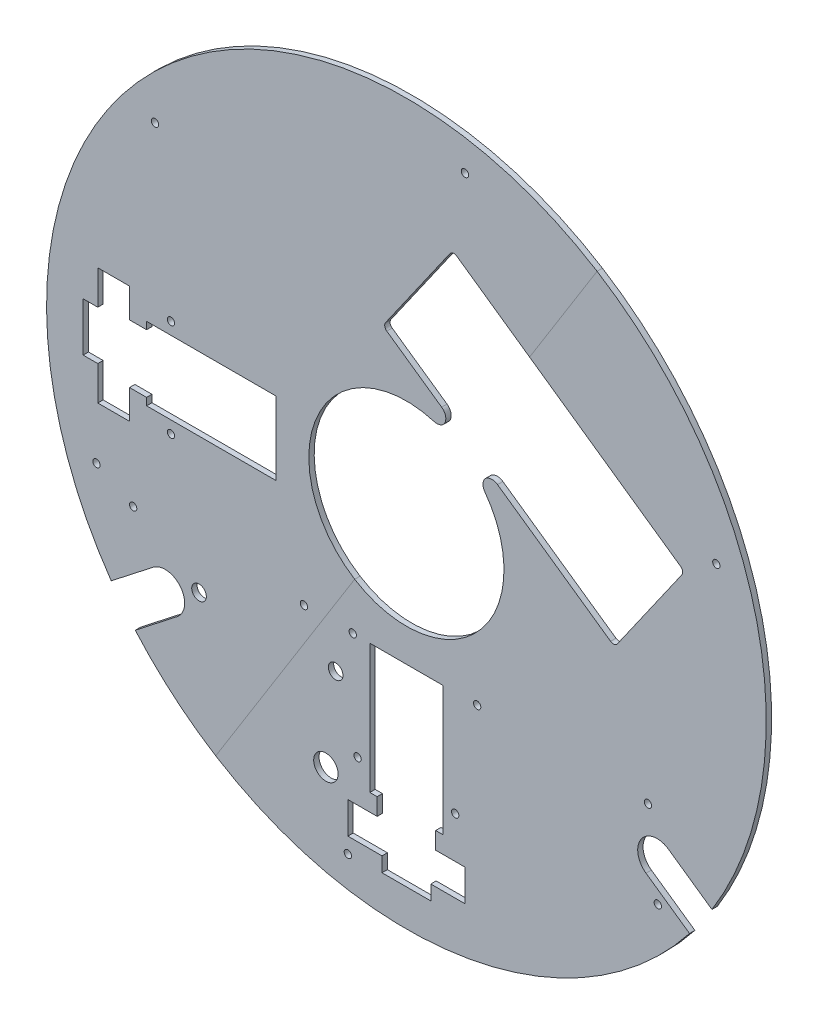
from build123d import *

# Parameters (mm, degrees)
SKETCH1_R           = 147.5
BOSS_EXTRUDE1_DEPTH = 2.2
CUT_EXTRUDE1_REACH  = 210.608
CUT_EXTRUDE2_REACH  = 210.608
SKETCH3_R           = 1.5
CIRPATTERN2_COUNT   = 2
CIRPATTERN2_ANGLE   = 90
CUT_EXTRUDE3_REACH  = 210.608
SKETCH4_R           = 1.5
CIRPATTERN3_COUNT   = 6
CUT_EXTRUDE4_REACH  = 210.608
SKETCH5_R           = 40
CUT_EXTRUDE5_REACH  = 210.608
SKETCH6_R           = 5
CUT_EXTRUDE6_REACH  = 210.608
SKETCH7_R           = 3
CUT_EXTRUDE7_REACH  = 210.608
SKETCH8_R           = 1.5
CUT_EXTRUDE8_REACH  = 210.608
CIRPATTERN4_COUNT   = 2
CIRPATTERN4_ANGLE   = 107
CUT_EXTRUDE9_REACH  = 210.608
CUT_EXTRUDE10_REACH = 210.608
FILLET2_R           = 4
FILLET3_R           = 2


# Read off the part's stored shape, not the designer's step: Split1
with BuildPart() as part:
    # Sketch1 → Boss-Extrude1 (new body)
    with BuildSketch(Plane.XY):
        Circle(SKETCH1_R)
    extrude(amount=BOSS_EXTRUDE1_DEPTH)

    # Sketch2 → Cut-Extrude1 (cut, up to next)
    with BuildSketch(Plane.XY.offset(2.2), mode=Mode.PRIVATE) as cut_extrude1_sk1:
        Polygon((-10, -132.5), (10, -132.5), (10, -126.5), (24, -126.5), (24, -113.5), (12, -113.5), (12, -106.5), (15, -106.5), (15, -53.5), (-15, -53.5), (-15, -106.5), (-12, -106.5), (-12, -113.5), (-24, -113.5), (-24, -126.5), (-10, -126.5), align=None)
    cut_extrude1_tool1 = extrude(cut_extrude1_sk1.sketch, amount=-CUT_EXTRUDE1_REACH, mode=Mode.PRIVATE) & part.part
    cut_extrude1 = cut_extrude1_tool1.solids().sort_by_distance((0, -94.364508, 2.2))[0]
    add(cut_extrude1, mode=Mode.SUBTRACT)

    # Sketch3 → Cut-Extrude2 (cut, up to next)
    with BuildSketch(Plane.XY.offset(2.2), mode=Mode.PRIVATE) as cut_extrude2_sk1:
        with Locations((20, -96.5)):
            Circle(SKETCH3_R)
    cut_extrude2_tool1 = extrude(cut_extrude2_sk1.sketch, amount=-CUT_EXTRUDE2_REACH, mode=Mode.PRIVATE) & part.part
    # Sketch3 → Cut-Extrude2 (cut, up to next)
    with BuildSketch(Plane.XY.offset(2.2), mode=Mode.PRIVATE) as cut_extrude2_sk2:
        with Locations((-20, -96.5)):
            Circle(SKETCH3_R)
    cut_extrude2_tool2 = extrude(cut_extrude2_sk2.sketch, amount=-CUT_EXTRUDE2_REACH, mode=Mode.PRIVATE) & part.part
    cut_extrude2_1 = cut_extrude2_tool1.solids().sort_by_distance((20, -96.5, 2.2))[0]
    add(cut_extrude2_1, mode=Mode.SUBTRACT)
    cut_extrude2_2 = cut_extrude2_tool2.solids().sort_by_distance((-20, -96.5, 2.2))[0]
    add(cut_extrude2_2, mode=Mode.SUBTRACT)
    cut_extrude2 = cut_extrude2_1 + cut_extrude2_2  # Cut-Extrude2 as one shape, for the pattern or mirror that repeats it

    # CirPattern2: Cut-Extrude1, Cut-Extrude2 ×2 about axis
    cirpattern2_axis = Axis((0, 0, 0), (0, 0, -1))
    add([cut_extrude1.rotate(cirpattern2_axis, i * CIRPATTERN2_ANGLE / (CIRPATTERN2_COUNT - 1)) for i in range(1, CIRPATTERN2_COUNT)], mode=Mode.SUBTRACT)
    add([cut_extrude2.rotate(cirpattern2_axis, i * CIRPATTERN2_ANGLE / (CIRPATTERN2_COUNT - 1)) for i in range(1, CIRPATTERN2_COUNT)], mode=Mode.SUBTRACT)

    # Sketch4 → Cut-Extrude3 (cut, up to next)
    with BuildSketch(Plane.XY.offset(2.2), mode=Mode.PRIVATE) as cut_extrude3_sk1:
        with Locations((-24, -132.849538953)):
            Circle(SKETCH4_R)
    cut_extrude3_tool1 = extrude(cut_extrude3_sk1.sketch, amount=-CUT_EXTRUDE3_REACH, mode=Mode.PRIVATE) & part.part
    cut_extrude3 = cut_extrude3_tool1.solids().sort_by_distance((-24, -132.849539, 2.2))[0]
    add(cut_extrude3, mode=Mode.SUBTRACT)

    # CirPattern3: Cut-Extrude3 ×6 about axis
    cirpattern3_axis = Axis((0, 0, 0), (0, 0, 1))
    for i in range(1, CIRPATTERN3_COUNT):
        add(cut_extrude3.rotate(cirpattern3_axis, i * 360 / CIRPATTERN3_COUNT), mode=Mode.SUBTRACT)

    # Sketch5 → Cut-Extrude4 (cut, up to next)
    with BuildSketch(Plane.XY.offset(2.2), mode=Mode.PRIVATE) as cut_extrude4_sk1:
        Circle(SKETCH5_R)
    cut_extrude4_tool1 = extrude(cut_extrude4_sk1.sketch, amount=-CUT_EXTRUDE4_REACH, mode=Mode.PRIVATE) & part.part
    add(cut_extrude4_tool1.solids().sort_by_distance((0, 0, 2.2))[0], mode=Mode.SUBTRACT)

    # Sketch6 → Cut-Extrude5 (cut, up to next)
    with BuildSketch(Plane.XY.offset(2.2), mode=Mode.PRIVATE) as cut_extrude5_sk1:
        with Locations((-33, -106.5)):
            Circle(SKETCH6_R)
    cut_extrude5_tool1 = extrude(cut_extrude5_sk1.sketch, amount=-CUT_EXTRUDE5_REACH, mode=Mode.PRIVATE) & part.part
    add(cut_extrude5_tool1.solids().sort_by_distance((-33, -106.5, 2.2))[0], mode=Mode.SUBTRACT)

    # Sketch7 → Cut-Extrude6 (cut, up to next)
    with BuildSketch(Plane.XY.offset(2.2), mode=Mode.PRIVATE) as cut_extrude6_sk1:
        with Locations((-29, -70.5)):
            Circle(SKETCH7_R)
    cut_extrude6_tool1 = extrude(cut_extrude6_sk1.sketch, amount=-CUT_EXTRUDE6_REACH, mode=Mode.PRIVATE) & part.part
    # Sketch7 → Cut-Extrude6 (cut, up to next)
    with BuildSketch(Plane.XY.offset(2.2), mode=Mode.PRIVATE) as cut_extrude6_sk2:
        with Locations((-85, -70.5)):
            Circle(SKETCH7_R)
    cut_extrude6_tool2 = extrude(cut_extrude6_sk2.sketch, amount=-CUT_EXTRUDE6_REACH, mode=Mode.PRIVATE) & part.part
    add(cut_extrude6_tool1.solids().sort_by_distance((-29, -70.5, 2.2))[0], mode=Mode.SUBTRACT)
    add(cut_extrude6_tool2.solids().sort_by_distance((-85, -70.5, 2.2))[0], mode=Mode.SUBTRACT)

    # Sketch8 → Cut-Extrude7 (cut, up to next)
    with BuildSketch(Plane.XY.offset(2.2), mode=Mode.PRIVATE) as cut_extrude7_sk1:
        with Locations((29, -53.5)):
            Circle(SKETCH8_R)
    cut_extrude7_tool1 = extrude(cut_extrude7_sk1.sketch, amount=-CUT_EXTRUDE7_REACH, mode=Mode.PRIVATE) & part.part
    # Sketch8 → Cut-Extrude7 (cut, up to next)
    with BuildSketch(Plane.XY.offset(2.2), mode=Mode.PRIVATE) as cut_extrude7_sk2:
        with Locations((99, -53.5)):
            Circle(SKETCH8_R)
    cut_extrude7_tool2 = extrude(cut_extrude7_sk2.sketch, amount=-CUT_EXTRUDE7_REACH, mode=Mode.PRIVATE) & part.part
    # Sketch8 → Cut-Extrude7 (cut, up to next)
    with BuildSketch(Plane.XY.offset(2.2), mode=Mode.PRIVATE) as cut_extrude7_sk3:
        with Locations((-22, -53.5)):
            Circle(SKETCH8_R)
    cut_extrude7_tool3 = extrude(cut_extrude7_sk3.sketch, amount=-CUT_EXTRUDE7_REACH, mode=Mode.PRIVATE) & part.part
    # Sketch8 → Cut-Extrude7 (cut, up to next)
    with BuildSketch(Plane.XY.offset(2.2), mode=Mode.PRIVATE) as cut_extrude7_sk4:
        with Locations((-42, -53.5)):
            Circle(SKETCH8_R)
    cut_extrude7_tool4 = extrude(cut_extrude7_sk4.sketch, amount=-CUT_EXTRUDE7_REACH, mode=Mode.PRIVATE) & part.part
    # Sketch8 → Cut-Extrude7 (cut, up to next)
    with BuildSketch(Plane.XY.offset(2.2), mode=Mode.PRIVATE) as cut_extrude7_sk5:
        with Locations((-112, -53.5)):
            Circle(SKETCH8_R)
    cut_extrude7_tool5 = extrude(cut_extrude7_sk5.sketch, amount=-CUT_EXTRUDE7_REACH, mode=Mode.PRIVATE) & part.part
    add(cut_extrude7_tool1.solids().sort_by_distance((29, -53.5, 2.2))[0], mode=Mode.SUBTRACT)
    add(cut_extrude7_tool2.solids().sort_by_distance((99, -53.5, 2.2))[0], mode=Mode.SUBTRACT)
    add(cut_extrude7_tool3.solids().sort_by_distance((-22, -53.5, 2.2))[0], mode=Mode.SUBTRACT)
    add(cut_extrude7_tool4.solids().sort_by_distance((-42, -53.5, 2.2))[0], mode=Mode.SUBTRACT)
    add(cut_extrude7_tool5.solids().sort_by_distance((-112, -53.5, 2.2))[0], mode=Mode.SUBTRACT)

    # Sketch9 → Cut-Extrude8 (cut, up to next)
    with BuildSketch(Plane.XY.offset(2.2), mode=Mode.PRIVATE) as cut_extrude8_sk1:
        with BuildLine():
            Line((116.236315042, -91.155740716), (125.413538023, -78.049308007))
            Line((125.413538023, -78.049308007), (107.392193049, -65.430626408))
            ThreePointArc((107.392193049, -65.430626408), (96.250365204, -67.395231271), (98.214970067, -78.537059116))
            Line((98.214970067, -78.537059116), (116.236315042, -91.155740716))
        make_face()
    cut_extrude8_tool1 = extrude(cut_extrude8_sk1.sketch, amount=-CUT_EXTRUDE8_REACH, mode=Mode.PRIVATE) & part.part
    cut_extrude8 = cut_extrude8_tool1.solids().sort_by_distance((109.194642, -76.458912, 2.2))[0]
    add(cut_extrude8, mode=Mode.SUBTRACT)

    # CirPattern4: Cut-Extrude8 ×2 about axis
    cirpattern4_axis = Axis((0, 0, 0), (0, 0, -1))
    for i in range(1, CIRPATTERN4_COUNT):
        add(cut_extrude8.rotate(cirpattern4_axis, i * CIRPATTERN4_ANGLE / (CIRPATTERN4_COUNT - 1)), mode=Mode.SUBTRACT)

    # Sketch10 → Cut-Extrude9 (cut, up to next)
    with BuildSketch(Plane.XY.offset(2.2), mode=Mode.PRIVATE) as cut_extrude9_sk1:
        Polygon((19, 102.849538953), (114.021637138, 36.314672336), (85.34281532, -4.642929878), (-9.678821818, 61.891936738), align=None)
    cut_extrude9_tool1 = extrude(cut_extrude9_sk1.sketch, amount=-CUT_EXTRUDE9_REACH, mode=Mode.PRIVATE) & part.part
    add(cut_extrude9_tool1.solids().sort_by_distance((52.171408, 49.103305, 2.2))[0], mode=Mode.SUBTRACT)

    # Sketch11 → Cut-Extrude10 (cut, up to next)
    with BuildSketch(Plane.XY.offset(2.2), mode=Mode.PRIVATE) as cut_extrude10_sk1:
        with BuildLine():
            Line((25.942740388, 37.050072974), (17.720285388, 42.706875333))
            Line((17.720285388, 42.706875333), (13.995022634, 37.386648757))
            ThreePointArc((13.995022634, 37.386648757), (22.905723673, 32.694800608), (30.358763136, 25.922339104))
            Line((30.358763136, 25.922339104), (34.086983666, 31.246789823))
            Line((34.086983666, 31.246789823), (25.942740388, 37.050072974))
        make_face()
    cut_extrude10_tool1 = extrude(cut_extrude10_sk1.sketch, amount=-CUT_EXTRUDE10_REACH, mode=Mode.PRIVATE) & part.part
    add(cut_extrude10_tool1.solids().sort_by_distance((24.289754, 34.669417, 2.2))[0], mode=Mode.SUBTRACT)

    # Fillet2
    # the kernel refuses this fillet: 4 mm, written as the material it takes off along each edge
    with BuildSketch(Plane(origin=(30.406040301, 25.989857892, -7.458684418), x_dir=(0.5735764363510447, 0.8191520442889928, 0), z_dir=(0, 0, 1))) as fillet2_piece_1:
        with BuildLine():
            CenterArc((2.983473767, -4), FILLET2_R, 90, 71.446995465)
            ThreePointArc((-0.808645072, -2.727272727), (-0.380070857, -1.370827064), (0, 0))
            Line((0, 0), (2.983473767, 0))
        make_face()
    extrude(amount=17.117368836, mode=Mode.SUBTRACT)
    with BuildSketch(Plane(origin=(34.086983666, 31.246789823, 12.2), x_dir=(-0.5735764363510458, -0.819152044288992, 0), z_dir=(0, 0, -1)), Plane(origin=(17.720285388, 42.706875333, 12.2), x_dir=(-0.8191520442889926, 0.5735764363510452, 0), z_dir=(0, 0, -1))) as fillet2_piece_2:
        with BuildLine():
            CenterArc((FILLET2_R, -FILLET2_R), FILLET2_R, 90, 90)
            Line((0, -FILLET2_R), (0, 0))
            Line((0, 0), (FILLET2_R, 0))
        make_face()
    extrude(amount=22.2, mode=Mode.SUBTRACT)
    with BuildSketch(Plane(origin=(14.042293504, 37.454158556, -7.462546567), x_dir=(0.5735764363510463, 0.8191520442889917, 0), z_dir=(0, 0, 1))) as fillet2_piece_3:
        with BuildLine():
            CenterArc((2.985018627, 4), FILLET2_R, 198.525603309, 71.474396691)
            ThreePointArc((-0.80770845, 2.729086422), (-0.379573844, 1.371729304), (0, 0))
            Line((0, 0), (2.985018627, 0))
        make_face()
    extrude(amount=17.125093133, mode=Mode.SUBTRACT)

    # Fillet3
    fillet3_edges = [part.edges().sort_by_distance(p)[0] for p in [
        (114.021637138, 36.314672336, 1.1),
        (85.34281532, -4.642929878, 1.1),
        (-9.678821818, 61.891936738, 1.1),
        (19, 102.849538953, 1.1),
    ]]
    fillet(fillet3_edges, radius=FILLET3_R)


with BuildPart() as body_2:
    # Split1: the piece on the far side of the plane
    add(part.part)
    split(bisect_by=Plane(origin=(0, 0, 0), x_dir=(0.5299192642332059, 0.8480480961564255, 0), z_dir=(0.8480480961564253, -0.5299192642332062, 0)), keep=Keep.BOTTOM)


with BuildPart() as part_1:
    add(part.part)

    # Split1
    split(bisect_by=Plane(origin=(0, 0, 0), x_dir=(0.5299192642332059, 0.8480480961564255, 0), z_dir=(0.8480480961564253, -0.5299192642332062, 0)), keep=Keep.TOP)


solid = Compound([body_2.part, part_1.part])
